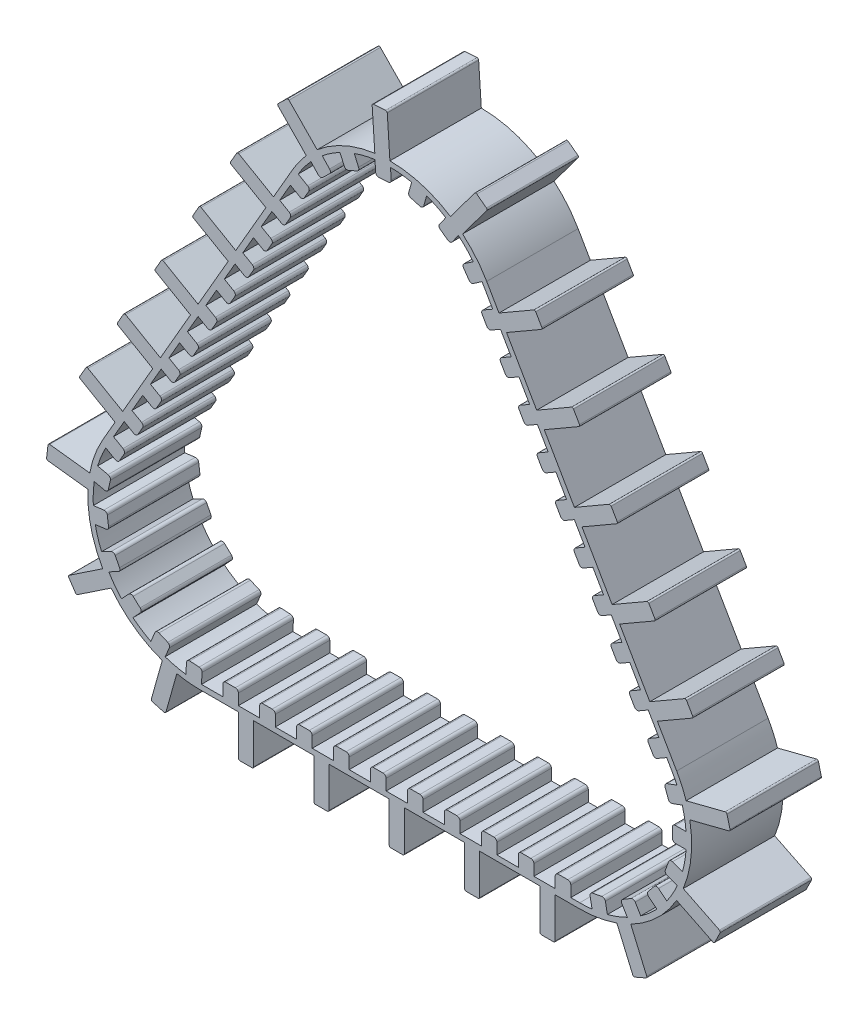
from build123d import *

# Parameters (mm, degrees)
EXTRUDE_THIN1_DEPTH = 60
BOSS_EXTRUDE4_DEPTH = 60
FILLET3_R           = 2
CRVPATTERN6_DEPTH   = 60
BOSS_EXTRUDE5_DEPTH = 60
FILLET4_R           = 1
CRVPATTERN8_DEPTH   = 60


# Read off the part's stored shape, not the designer's step: CrvPattern6, CrvPattern8
with BuildPart() as part:
    # Sketch2 → Extrude-Thin1 (new body)
    with BuildSketch(Plane.XY):
        with BuildLine():
            Line((-249.41531629, -73.5), (0, -73.5))
            ThreePointArc((0, -73.5), (63.652867178, -36.75), (63.652867178, 36.75))
            Line((63.652867178, 36.75), (-61.054790967, 252.75))
            ThreePointArc((-61.054790967, 252.75), (-124.707658145, 289.5), (-188.360525323, 252.75))
            Line((-188.360525323, 252.75), (-313.068183468, 36.75))
            ThreePointArc((-313.068183468, 36.75), (-313.068183468, -36.75), (-249.41531629, -73.5))
        make_face()
        with BuildLine():
            Line((-249.41531629, -70), (0, -70))
            ThreePointArc((0, -70), (60.621778265, -35), (60.621778265, 35))
            Line((60.621778265, 35), (-64.08587988, 251))
            ThreePointArc((-64.08587988, 251), (-124.707658145, 286), (-185.32943641, 251))
            Line((-185.32943641, 251), (-310.037094555, 35))
            ThreePointArc((-310.037094555, 35), (-310.037094555, -35), (-249.41531629, -70))
        make_face(mode=Mode.SUBTRACT)
    extrude(amount=EXTRUDE_THIN1_DEPTH)

    # Sketch4 → Boss-Extrude4 (add)
    with BuildSketch(Plane.XY.offset(60)):
        Polygon((-254.685847855, 112.471171547), (-249.570790282, 121.330711146), (-257.538223997, 125.930711146), (-262.65328157, 117.071171547), align=None)
    extrude(amount=-BOSS_EXTRUDE4_DEPTH)

    # Fillet3
    fillet3_edges = [part.edges().sort_by_distance(p)[0] for p in [
        (-249.570790282, 121.330711146, 30),
        (-254.685847855, 112.471171547, 30),
    ]]
    fillet(fillet3_edges, radius=FILLET3_R)

    # CrvPattern6 outline → CrvPattern6 (add)
    with BuildSketch(Plane.XY):
        with BuildLine():
            ThreePointArc((-244.294746414, 134.46908719), (-242.777108324, 134.269286345), (-241.562695606, 135.201137997))
            Line((-241.562695606, 135.201137997), (-238.447638033, 140.596575981))
            ThreePointArc((-238.447638033, 140.596575981), (-238.247837188, 142.114214072), (-239.179688841, 143.328626789))
            Line((-239.179688841, 143.328626789), (-245.415071748, 146.928626789))
            Line((-245.415071748, 146.928626789), (-250.530129321, 138.06908719))
            Line((-250.530129321, 138.06908719), (-244.294746414, 134.46908719))
        make_face()
        with BuildLine():
            Line((-269.661376246, 104.932795503), (-274.776433819, 96.073255904))
            Line((-274.776433819, 96.073255904), (-268.541050911, 92.473255904))
            ThreePointArc((-268.541050911, 92.473255904), (-267.02341282, 92.273455059), (-265.809000103, 93.205306712))
            Line((-265.809000103, 93.205306712), (-262.693942531, 98.600744696))
            ThreePointArc((-262.693942531, 98.600744696), (-262.494141686, 100.118382786), (-263.425993338, 101.332795503))
            Line((-263.425993338, 101.332795503), (-269.661376246, 104.932795503))
        make_face()
        with BuildLine():
            Line((-281.784528495, 83.934879861), (-286.899586067, 75.075340262))
            Line((-286.899586067, 75.075340262), (-280.66420316, 71.475340262))
            ThreePointArc((-280.66420316, 71.475340262), (-279.14656507, 71.275539417), (-277.932152352, 72.207391069))
            Line((-277.932152352, 72.207391069), (-274.81709478, 77.602829053))
            ThreePointArc((-274.81709478, 77.602829053), (-274.617293935, 79.120467143), (-275.549145587, 80.334879861))
            Line((-275.549145587, 80.334879861), (-281.784528495, 83.934879861))
        make_face()
        with BuildLine():
            Line((-293.907680743, 62.936964218), (-299.022738316, 54.077424619))
            Line((-299.022738316, 54.077424619), (-292.787355408, 50.477424619))
            ThreePointArc((-292.787355408, 50.477424619), (-291.269717318, 50.277623774), (-290.055304601, 51.209475427))
            Line((-290.055304601, 51.209475427), (-286.940247028, 56.604913411))
            ThreePointArc((-286.940247028, 56.604913411), (-286.740446183, 58.122551501), (-287.672297836, 59.336964218))
            Line((-287.672297836, 59.336964218), (-293.907680743, 62.936964218))
        make_face()
        with BuildLine():
            ThreePointArc((-310.037094555, 35), (-310.583954637, 34.035241776), (-311.11546246, 33.061941302))
            Line((-311.11546246, 33.061941302), (-304.910507657, 29.479508976))
            ThreePointArc((-304.910507657, 29.479508976), (-303.392869566, 29.279708131), (-302.178456849, 30.211559784))
            Line((-302.178456849, 30.211559784), (-299.063399277, 35.606997768))
            ThreePointArc((-299.063399277, 35.606997768), (-298.863598432, 37.124635859), (-299.795450085, 38.339048576))
            Line((-299.795450085, 38.339048576), (-306.030832992, 41.939048576))
            Line((-306.030832992, 41.939048576), (-310.037094555, 35))
        make_face()
        with BuildLine():
            ThreePointArc((-316.457199384, 20.134197557), (-317.749224081, 15.181470482), (-318.675887828, 10.147572628))
            Line((-318.675887828, 10.147572628), (-311.829937788, 8.626635339))
            ThreePointArc((-311.829937788, 8.626635339), (-310.322340092, 8.891767267), (-309.443784123, 10.145276405))
            Line((-309.443784123, 10.145276405), (-308.092608277, 16.227106603))
            ThreePointArc((-308.092608277, 16.227106603), (-308.357740205, 17.734704298), (-309.611249343, 18.613260268))
            Line((-309.611249343, 18.613260268), (-316.457199384, 20.134197557))
        make_face()
        with BuildLine():
            ThreePointArc((-319.310913805, -3.821707469), (-318.844797619, -8.918919354), (-318.007462777, -13.968444447))
            Line((-318.007462777, -13.968444447), (-311.051754025, -13.074913281))
            ThreePointArc((-311.051754025, -13.074913281), (-309.723703566, -12.313711778), (-309.322880826, -10.836387547))
            Line((-309.322880826, -10.836387547), (-310.116679319, -4.657049503))
            ThreePointArc((-310.116679319, -4.657049503), (-310.877880823, -3.328999044), (-312.355205053, -2.928176303))
            Line((-312.355205053, -2.928176303), (-319.310913805, -3.821707469))
        make_face()
        with BuildLine():
            ThreePointArc((-313.862328281, -27.323664567), (-311.693437164, -31.959907078), (-309.191563575, -36.425269532))
            Line((-309.191563575, -36.425269532), (-302.952305235, -33.223404832))
            ThreePointArc((-302.952305235, -33.223404832), (-301.961549763, -32.056550366), (-302.086070555, -30.530889748))
            Line((-302.086070555, -30.530889748), (-304.930554857, -24.988034547))
            ThreePointArc((-304.930554857, -24.988034547), (-306.097409323, -23.997279075), (-307.623069941, -24.121799867))
            Line((-307.623069941, -24.121799867), (-313.862328281, -27.323664567))
        make_face()
        with BuildLine():
            ThreePointArc((-300.758633664, -47.580077354), (-297.144591633, -51.204650914), (-293.275355453, -54.555448533))
            Line((-293.275355453, -54.555448533), (-288.493655635, -49.42557241))
            ThreePointArc((-288.493655635, -49.42557241), (-287.957878514, -47.991665639), (-288.592952079, -46.598888802))
            Line((-288.592952079, -46.598888802), (-293.150250239, -42.350904786))
            ThreePointArc((-293.150250239, -42.350904786), (-294.58415701, -41.815127665), (-295.976933846, -42.450201231))
            Line((-295.976933846, -42.450201231), (-300.758633664, -47.580077354))
        make_face()
        with BuildLine():
            ThreePointArc((-281.556305711, -62.184859886), (-276.926393894, -64.367232417), (-272.14938858, -66.205452624))
            Line((-272.14938858, -66.205452624), (-269.393224489, -59.756899166))
            ThreePointArc((-269.393224489, -59.756899166), (-269.376066099, -58.226261606), (-270.446257484, -57.131804594))
            Line((-270.446257484, -57.131804594), (-276.175047049, -54.683273433))
            ThreePointArc((-276.175047049, -54.683273433), (-277.705684609, -54.666115044), (-278.800141621, -55.736306428))
            Line((-278.800141621, -55.736306428), (-281.556305711, -62.184859886))
        make_face()
        with BuildLine():
            Line((-249.41531629, -70), (-248.323526656, -70))
            Line((-248.323526656, -70), (-247.919788576, -62.990215199))
            ThreePointArc((-247.919788576, -62.990215199), (-248.423287016, -61.544658188), (-249.801477342, -60.878522184))
            Line((-249.801477342, -60.878522184), (-256.02128442, -60.520283945))
            ThreePointArc((-256.02128442, -60.520283945), (-257.466841431, -61.023782385), (-258.132977435, -62.40197271))
            Line((-258.132977435, -62.40197271), (-258.53622465, -69.403235016))
            ThreePointArc((-258.53622465, -69.403235016), (-253.985521366, -69.850649428), (-249.41531629, -70))
        make_face()
        with BuildLine():
            Line((-234.311365102, -70), (-224.081249957, -70))
            Line((-224.081249957, -70), (-224.081249957, -62.8))
            ThreePointArc((-224.081249957, -62.8), (-224.667036395, -61.385786437), (-226.081249957, -60.8))
            Line((-226.081249957, -60.8), (-232.311365102, -60.8))
            ThreePointArc((-232.311365102, -60.8), (-233.725578664, -61.385786438), (-234.311365102, -62.8))
            Line((-234.311365102, -62.8), (-234.311365102, -70))
        make_face()
        with BuildLine():
            Line((-210.065060604, -70), (-199.834945459, -70))
            Line((-199.834945459, -70), (-199.834945459, -62.8))
            ThreePointArc((-199.834945459, -62.8), (-200.420731897, -61.385786438), (-201.834945459, -60.8))
            Line((-201.834945459, -60.8), (-208.065060604, -60.8))
            ThreePointArc((-208.065060604, -60.8), (-209.479274167, -61.385786437), (-210.065060604, -62.8))
            Line((-210.065060604, -62.8), (-210.065060604, -70))
        make_face()
        with BuildLine():
            Line((-185.818756107, -70), (-175.588640962, -70))
            Line((-175.588640962, -70), (-175.588640962, -62.8))
            ThreePointArc((-175.588640962, -62.8), (-176.1744274, -61.385786438), (-177.588640962, -60.8))
            Line((-177.588640962, -60.8), (-183.818756107, -60.8))
            ThreePointArc((-183.818756107, -60.8), (-185.232969669, -61.385786438), (-185.818756107, -62.8))
            Line((-185.818756107, -62.8), (-185.818756107, -70))
        make_face()
        with BuildLine():
            Line((-161.57245161, -70), (-151.342336465, -70))
            Line((-151.342336465, -70), (-151.342336465, -62.8))
            ThreePointArc((-151.342336465, -62.8), (-151.928122903, -61.385786438), (-153.342336465, -60.8))
            Line((-153.342336465, -60.8), (-159.57245161, -60.8))
            ThreePointArc((-159.57245161, -60.8), (-160.986665172, -61.385786438), (-161.57245161, -62.8))
            Line((-161.57245161, -62.8), (-161.57245161, -70))
        make_face()
        with BuildLine():
            Line((-137.326147112, -70), (-127.096031967, -70))
            Line((-127.096031967, -70), (-127.096031967, -62.8))
            ThreePointArc((-127.096031967, -62.8), (-127.681818405, -61.385786438), (-129.096031967, -60.8))
            Line((-129.096031967, -60.8), (-135.326147112, -60.8))
            ThreePointArc((-135.326147112, -60.8), (-136.740360675, -61.385786437), (-137.326147112, -62.8))
            Line((-137.326147112, -62.8), (-137.326147112, -70))
        make_face()
        with BuildLine():
            Line((-113.079842615, -70), (-102.84972747, -70))
            Line((-102.84972747, -70), (-102.84972747, -62.8))
            ThreePointArc((-102.84972747, -62.8), (-103.435513907, -61.385786437), (-104.84972747, -60.8))
            Line((-104.84972747, -60.8), (-111.079842615, -60.8))
            ThreePointArc((-111.079842615, -60.8), (-112.494056177, -61.385786438), (-113.079842615, -62.8))
            Line((-113.079842615, -62.8), (-113.079842615, -70))
        make_face()
        with BuildLine():
            Line((-88.833538117, -70), (-78.603422972, -70))
            Line((-78.603422972, -70), (-78.603422972, -62.8))
            ThreePointArc((-78.603422972, -62.8), (-79.18920941, -61.385786438), (-80.603422972, -60.8))
            Line((-80.603422972, -60.8), (-86.833538117, -60.8))
            ThreePointArc((-86.833538117, -60.8), (-88.247751679, -61.385786438), (-88.833538117, -62.8))
            Line((-88.833538117, -62.8), (-88.833538117, -70))
        make_face()
        with BuildLine():
            Line((-64.58723362, -70), (-54.357118475, -70))
            Line((-54.357118475, -70), (-54.357118475, -62.8))
            ThreePointArc((-54.357118475, -62.8), (-54.942904913, -61.385786438), (-56.357118475, -60.8))
            Line((-56.357118475, -60.8), (-62.58723362, -60.8))
            ThreePointArc((-62.58723362, -60.8), (-64.001447182, -61.385786438), (-64.58723362, -62.8))
            Line((-64.58723362, -62.8), (-64.58723362, -70))
        make_face()
        with BuildLine():
            Line((-40.340929123, -70), (-30.110813978, -70))
            Line((-30.110813978, -70), (-30.110813978, -62.8))
            ThreePointArc((-30.110813978, -62.8), (-30.696600416, -61.385786437), (-32.110813978, -60.8))
            Line((-32.110813978, -60.8), (-38.340929123, -60.8))
            ThreePointArc((-38.340929123, -60.8), (-39.755142685, -61.385786438), (-40.340929123, -62.8))
            Line((-40.340929123, -62.8), (-40.340929123, -70))
        make_face()
        with BuildLine():
            Line((-16.094624625, -70), (-5.86450948, -70))
            Line((-5.86450948, -70), (-5.86450948, -62.8))
            ThreePointArc((-5.86450948, -62.8), (-6.450295918, -61.385786438), (-7.86450948, -60.8))
            Line((-7.86450948, -60.8), (-14.094624625, -60.8))
            ThreePointArc((-14.094624625, -60.8), (-15.508838188, -61.385786437), (-16.094624625, -62.8))
            Line((-16.094624625, -62.8), (-16.094624625, -70))
        make_face()
        with BuildLine():
            ThreePointArc((8.128735827, -69.526424141), (13.187457187, -68.746570627), (18.175669161, -67.599149777))
            Line((18.175669161, -67.599149777), (16.854499686, -60.711857609))
            ThreePointArc((16.854499686, -60.711857609), (16.01277555, -59.433324766), (14.513527463, -59.124454368))
            Line((14.513527463, -59.124454368), (8.394969594, -60.29815975))
            ThreePointArc((8.394969594, -60.29815975), (7.116436751, -61.139883886), (6.807566352, -62.639131973))
            Line((6.807566352, -62.639131973), (8.128735827, -69.526424141))
        make_face()
        with BuildLine():
            ThreePointArc((31.249564339, -62.637566433), (35.743091285, -60.186638263), (40.04551062, -57.413910154))
            Line((40.04551062, -57.413910154), (36.464632178, -51.384184474))
            ThreePointArc((36.464632178, -51.384184474), (35.238848166, -50.467342446), (33.723782763, -50.685797418))
            Line((33.723782763, -50.685797418), (28.367072955, -53.866991337))
            ThreePointArc((28.367072955, -53.866991337), (27.450230926, -55.092775349), (27.668685898, -56.607840752))
            Line((27.668685898, -56.607840752), (31.249564339, -62.637566433))
        make_face()
        with BuildLine():
            ThreePointArc((50.6585245, -48.308528186), (54.053109415, -44.477650146), (57.158688534, -40.408963425))
            Line((57.158688534, -40.408963425), (51.743443035, -35.953023751))
            ThreePointArc((51.743443035, -35.953023751), (50.27919954, -35.506776356), (48.928278477, -36.226608301))
            Line((48.928278477, -36.226608301), (44.969694451, -41.037423953))
            ThreePointArc((44.969694451, -41.037423953), (44.523447056, -42.501667448), (45.243279001, -43.852588512))
            Line((45.243279001, -43.852588512), (50.6585245, -48.308528186))
        make_face()
        with BuildLine():
            ThreePointArc((64.050192012, -28.241333242), (65.942621201, -23.485542555), (67.482474934, -18.604181702))
            Line((67.482474934, -18.604181702), (60.876093053, -16.251310979))
            ThreePointArc((60.876093053, -16.251310979), (59.347315031, -16.328664127), (58.32100266, -17.464370369))
            Line((58.32100266, -17.464370369), (56.230750741, -23.333372127))
            ThreePointArc((56.230750741, -23.333372127), (56.308103889, -24.862150149), (57.443810131, -25.88846252))
            Line((57.443810131, -25.88846252), (64.050192012, -28.241333242))
        make_face()
        with BuildLine():
            ThreePointArc((69.833885279, -4.819591979), (69.999373273, 0.296211675), (69.790595571, 5.410431573))
            Line((69.790595571, 5.410431573), (62.777792883, 5.380755964))
            ThreePointArc((62.777792883, 5.380755964), (61.366070793, 4.788990392), (60.78627398, 3.37231068))
            Line((60.78627398, 3.37231068), (60.812637306, -2.857748685))
            ThreePointArc((60.812637306, -2.857748685), (61.404402878, -4.269470774), (62.82108259, -4.849267588))
            Line((62.82108259, -4.849267588), (69.833885279, -4.819591979))
        make_face()
        with BuildLine():
            ThreePointArc((67.32260887, 19.174627375), (65.741498766, 24.042781454), (63.808888546, 28.782385978))
            Line((63.808888546, 28.782385978), (57.222655873, 26.373688949))
            ThreePointArc((57.222655873, 26.373688949), (56.095676104, 25.337801721), (56.03126395, 23.8084238))
            Line((56.03126395, 23.8084238), (58.171111048, 17.957322269))
            ThreePointArc((58.171111048, 17.957322269), (59.206998276, 16.8303425), (60.736376197, 16.765930346))
            Line((60.736376197, 16.765930346), (67.32260887, 19.174627375))
        make_face()
        with BuildLine():
            Line((57.11085342, 41.081100212), (51.995795848, 49.940639812))
            Line((51.995795848, 49.940639812), (45.760412941, 46.340639812))
            ThreePointArc((45.760412941, 46.340639812), (44.828561288, 45.126227095), (45.028362133, 43.608589004))
            Line((45.028362133, 43.608589004), (48.143419706, 38.21315102))
            ThreePointArc((48.143419706, 38.21315102), (49.357832423, 37.281299367), (50.875470513, 37.481100212))
            Line((50.875470513, 37.481100212), (57.11085342, 41.081100212))
        make_face()
        with BuildLine():
            Line((44.987701172, 62.079015855), (39.872643599, 70.938555454))
            Line((39.872643599, 70.938555454), (33.637260692, 67.338555454))
            ThreePointArc((33.637260692, 67.338555454), (32.705409039, 66.124142737), (32.905209884, 64.606504647))
            Line((32.905209884, 64.606504647), (36.020267457, 59.211066662))
            ThreePointArc((36.020267457, 59.211066662), (37.234680174, 58.27921501), (38.752318264, 58.479015855))
            Line((38.752318264, 58.479015855), (44.987701172, 62.079015855))
        make_face()
        with BuildLine():
            Line((32.864548923, 83.076931498), (27.74949135, 91.936471097))
            Line((27.74949135, 91.936471097), (21.514108443, 88.336471097))
            ThreePointArc((21.514108443, 88.336471097), (20.582256791, 87.122058379), (20.782057636, 85.604420289))
            Line((20.782057636, 85.604420289), (23.897115208, 80.208982305))
            ThreePointArc((23.897115208, 80.208982305), (25.111527926, 79.277130653), (26.629166016, 79.476931498))
            Line((26.629166016, 79.476931498), (32.864548923, 83.076931498))
        make_face()
        with BuildLine():
            Line((20.741396674, 104.07484714), (15.626339102, 112.934386739))
            Line((15.626339102, 112.934386739), (9.390956195, 109.334386739))
            ThreePointArc((9.390956195, 109.334386739), (8.459104542, 108.119974022), (8.658905387, 106.602335932))
            Line((8.658905387, 106.602335932), (11.773962959, 101.206897948))
            ThreePointArc((11.773962959, 101.206897948), (12.988375676, 100.275046295), (14.506013767, 100.47484714))
            Line((14.506013767, 100.47484714), (20.741396674, 104.07484714))
        make_face()
        with BuildLine():
            Line((8.618244426, 125.072762783), (3.503186853, 133.932302382))
            Line((3.503186853, 133.932302382), (-2.732196054, 130.332302382))
            ThreePointArc((-2.732196054, 130.332302382), (-3.664047707, 129.117889665), (-3.464246862, 127.600251574))
            Line((-3.464246862, 127.600251574), (-0.349189289, 122.20481359))
            ThreePointArc((-0.349189289, 122.20481359), (0.865223428, 121.272961938), (2.382861518, 121.472762783))
            Line((2.382861518, 121.472762783), (8.618244426, 125.072762783))
        make_face()
        with BuildLine():
            Line((-3.504907823, 146.070678425), (-8.619965396, 154.930218025))
            Line((-8.619965396, 154.930218025), (-14.855348303, 151.330218025))
            ThreePointArc((-14.855348303, 151.330218025), (-15.787199955, 150.115805307), (-15.58739911, 148.598167217))
            Line((-15.58739911, 148.598167217), (-12.472341538, 143.202729233))
            ThreePointArc((-12.472341538, 143.202729233), (-11.257928821, 142.27087758), (-9.74029073, 142.470678425))
            Line((-9.74029073, 142.470678425), (-3.504907823, 146.070678425))
        make_face()
        with BuildLine():
            Line((-15.628060072, 167.068594068), (-20.743117644, 175.928133667))
            Line((-20.743117644, 175.928133667), (-26.978500552, 172.328133667))
            ThreePointArc((-26.978500552, 172.328133667), (-27.910352204, 171.11372095), (-27.710551359, 169.59608286))
            Line((-27.710551359, 169.59608286), (-24.595493787, 164.200644876))
            ThreePointArc((-24.595493787, 164.200644876), (-23.38108107, 163.268793223), (-21.863442979, 163.468594068))
            Line((-21.863442979, 163.468594068), (-15.628060072, 167.068594068))
        make_face()
        with BuildLine():
            Line((-27.75121232, 188.066509711), (-32.866269893, 196.92604931))
            Line((-32.866269893, 196.92604931), (-39.1016528, 193.32604931))
            ThreePointArc((-39.1016528, 193.32604931), (-40.033504453, 192.111636593), (-39.833703608, 190.593998502))
            Line((-39.833703608, 190.593998502), (-36.718646035, 185.198560518))
            ThreePointArc((-36.718646035, 185.198560518), (-35.504233318, 184.266708866), (-33.986595228, 184.466509711))
            Line((-33.986595228, 184.466509711), (-27.75121232, 188.066509711))
        make_face()
        with BuildLine():
            Line((-39.874364569, 209.064425353), (-44.989422142, 217.923964953))
            Line((-44.989422142, 217.923964953), (-51.224805049, 214.323964953))
            ThreePointArc((-51.224805049, 214.323964953), (-52.156656702, 213.109552236), (-51.956855857, 211.591914145))
            Line((-51.956855857, 211.591914145), (-48.841798284, 206.196476161))
            ThreePointArc((-48.841798284, 206.196476161), (-47.627385567, 205.264624508), (-46.109747476, 205.464425353))
            Line((-46.109747476, 205.464425353), (-39.874364569, 209.064425353))
        make_face()
        with BuildLine():
            Line((-51.997516818, 230.062340996), (-57.11257439, 238.921880595))
            Line((-57.11257439, 238.921880595), (-63.347957298, 235.321880595))
            ThreePointArc((-63.347957298, 235.321880595), (-64.27980895, 234.107467878), (-64.080008105, 232.589829788))
            Line((-64.080008105, 232.589829788), (-60.964950533, 227.194391804))
            ThreePointArc((-60.964950533, 227.194391804), (-59.750537816, 226.262540151), (-58.232899725, 226.462340996))
            Line((-58.232899725, 226.462340996), (-51.997516818, 230.062340996))
        make_face()
        with BuildLine():
            ThreePointArc((-64.118413713, 251.056289866), (-66.842032003, 255.389964601), (-69.875040476, 259.513032985))
            Line((-69.875040476, 259.513032985), (-75.67223836, 255.566796944))
            ThreePointArc((-75.67223836, 255.566796944), (-76.511670449, 254.28675807), (-76.200114404, 252.78806578))
            Line((-76.200114404, 252.78806578), (-72.69434276, 247.637929869))
            ThreePointArc((-72.69434276, 247.637929869), (-71.414303886, 246.79849778), (-69.915611596, 247.110053825))
            Line((-69.915611596, 247.110053825), (-64.118413713, 251.056289866))
        make_face()
        with BuildLine():
            ThreePointArc((-79.618149954, 269.543778827), (-83.651254454, 272.69542941), (-87.903875255, 275.543946501))
            Line((-87.903875255, 275.543946501), (-92.017061484, 269.863983365))
            ThreePointArc((-92.017061484, 269.863983365), (-92.372077331, 268.374987226), (-91.570232177, 267.071073847))
            Line((-91.570232177, 267.071073847), (-86.5242457, 263.416986384))
            ThreePointArc((-86.5242457, 263.416986384), (-85.035249562, 263.061970537), (-83.731336183, 263.86381569))
            Line((-83.731336183, 263.86381569), (-79.618149954, 269.543778827))
        make_face()
        with BuildLine():
            ThreePointArc((-100.47368305, 281.671260465), (-105.337215786, 283.266529291), (-110.304316479, 284.502144119))
            Line((-110.304316479, 284.502144119), (-112.244920858, 277.763128105))
            ThreePointArc((-112.244920858, 277.763128105), (-112.073351168, 276.242039813), (-110.876461231, 275.287786058))
            Line((-110.876461231, 275.287786058), (-104.889629475, 273.563784825))
            ThreePointArc((-104.889629475, 273.563784825), (-103.368541183, 273.735354514), (-102.414287428, 274.932244451))
            Line((-102.414287428, 274.932244451), (-100.47368305, 281.671260465))
        make_face()
        with BuildLine():
            ThreePointArc((-124.207762682, 285.99821501), (-129.324026217, 285.847613745), (-134.415607414, 285.323558196))
            Line((-134.415607414, 285.323558196), (-133.953122153, 278.325959353))
            ThreePointArc((-133.953122153, 278.325959353), (-133.275346222, 276.953455969), (-131.825579815, 276.462209476))
            Line((-131.825579815, 276.462209476), (-125.609027297, 276.873073829))
            ThreePointArc((-125.609027297, 276.873073829), (-124.236523914, 277.55084976), (-123.745277421, 279.000616166))
            Line((-123.745277421, 279.000616166), (-124.207762682, 285.99821501))
        make_face()
        with BuildLine():
            ThreePointArc((-148.001220619, 282.010680555), (-152.762497787, 280.132097835), (-157.373774124, 277.910619984))
            Line((-157.373774124, 277.910619984), (-154.56313389, 271.485623201))
            ThreePointArc((-154.56313389, 271.485623201), (-153.459658921, 270.424732659), (-151.929221391, 270.454844396))
            Line((-151.929221391, 270.454844396), (-146.221359191, 272.951771272))
            ThreePointArc((-146.221359191, 272.951771272), (-145.160468648, 274.055246241), (-145.190580385, 275.585683771))
            Line((-145.190580385, 275.585683771), (-148.001220619, 282.010680555))
        make_face()
        with BuildLine():
            ThreePointArc((-169.027835588, 270.182302197), (-172.868575015, 266.798878789), (-176.451812435, 263.143848982))
            Line((-176.451812435, 263.143848982), (-171.626869131, 258.054624649))
            ThreePointArc((-171.626869131, 258.054624649), (-170.228767473, 257.431361058), (-168.799446398, 257.979254309))
            Line((-168.799446398, 257.979254309), (-164.278262625, 262.265655131))
            ThreePointArc((-164.278262625, 262.265655131), (-163.654999034, 263.663756789), (-164.202892285, 265.093077865))
            Line((-164.202892285, 265.093077865), (-169.027835588, 270.182302197))
        make_face()
        with BuildLine():
            Line((-185.32943641, 251), (-189.914368077, 243.058665403))
            Line((-189.914368077, 243.058665403), (-183.67898517, 239.458665403))
            ThreePointArc((-183.67898517, 239.458665403), (-182.16134708, 239.258864558), (-180.946934363, 240.19071621))
            Line((-180.946934363, 240.19071621), (-177.83187679, 245.586154194))
            ThreePointArc((-177.83187679, 245.586154194), (-177.632075945, 247.103792285), (-178.563927598, 248.318205002))
            Line((-178.563927598, 248.318205002), (-184.792356331, 251.914190008))
            ThreePointArc((-184.792356331, 251.914190008), (-185.062627287, 251.458111905), (-185.32943641, 251))
        make_face()
        with BuildLine():
            Line((-196.922462754, 230.920289359), (-202.037520326, 222.06074976))
            Line((-202.037520326, 222.06074976), (-195.802137419, 218.46074976))
            ThreePointArc((-195.802137419, 218.46074976), (-194.284499328, 218.260948915), (-193.070086611, 219.192800568))
            Line((-193.070086611, 219.192800568), (-189.955029039, 224.588238552))
            ThreePointArc((-189.955029039, 224.588238552), (-189.755228194, 226.105876642), (-190.687079846, 227.320289359))
            Line((-190.687079846, 227.320289359), (-196.922462754, 230.920289359))
        make_face()
        with BuildLine():
            Line((-209.045615002, 209.922373717), (-214.160672575, 201.062834117))
            Line((-214.160672575, 201.062834117), (-207.925289667, 197.462834117))
            ThreePointArc((-207.925289667, 197.462834117), (-206.407651577, 197.263033272), (-205.19323886, 198.194884925))
            Line((-205.19323886, 198.194884925), (-202.078181287, 203.590322909))
            ThreePointArc((-202.078181287, 203.590322909), (-201.878380442, 205.107961), (-202.810232095, 206.322373717))
            Line((-202.810232095, 206.322373717), (-209.045615002, 209.922373717))
        make_face()
        with BuildLine():
            Line((-221.168767251, 188.924458074), (-226.283824823, 180.064918475))
            Line((-226.283824823, 180.064918475), (-220.048441916, 176.464918475))
            ThreePointArc((-220.048441916, 176.464918475), (-218.530803826, 176.26511763), (-217.316391109, 177.196969282))
            Line((-217.316391109, 177.196969282), (-214.201333536, 182.592407266))
            ThreePointArc((-214.201333536, 182.592407266), (-214.001532691, 184.110045357), (-214.933384344, 185.324458074))
            Line((-214.933384344, 185.324458074), (-221.168767251, 188.924458074))
        make_face()
        with BuildLine():
            Line((-233.2919195, 167.926542431), (-238.406977072, 159.067002832))
            Line((-238.406977072, 159.067002832), (-232.171594165, 155.467002832))
            ThreePointArc((-232.171594165, 155.467002832), (-230.653956074, 155.267201987), (-229.439543357, 156.19905364))
            Line((-229.439543357, 156.19905364), (-226.324485785, 161.594491624))
            ThreePointArc((-226.324485785, 161.594491624), (-226.12468494, 163.112129714), (-227.056536592, 164.326542431))
            Line((-227.056536592, 164.326542431), (-233.2919195, 167.926542431))
        make_face()
    extrude(amount=CRVPATTERN6_DEPTH)

    # Sketch6 → Boss-Extrude5 (add)
    with BuildSketch(Plane.XY.offset(60)):
        Polygon((-136.308864095, 316.253168116), (-126.401592242, 316.907959468), (-124.406757868, 286.725266347), (-134.314029721, 286.070474994), align=None)
    extrude(amount=-BOSS_EXTRUDE5_DEPTH)

    # Fillet4
    fillet4_edges = [part.edges().sort_by_distance(p)[0] for p in [
        (-126.401592242, 316.907959468, 30),
        (-136.308864095, 316.253168116, 30),
    ]]
    fillet(fillet4_edges, radius=FILLET4_R)

    # CrvPattern8 outline → CrvPattern8 (add)
    with BuildSketch(Plane.XY):
        with BuildLine():
            ThreePointArc((-67.591407991, 299.151011892), (-68.333266762, 299.339245794), (-68.990941598, 298.947773895))
            Line((-68.990941598, 298.947773895), (-84.82262764, 277.736815123))
            ThreePointArc((-84.82262764, 277.736815123), (-80.743794517, 274.901856463), (-76.865758962, 271.797873458))
            Line((-76.865758962, 271.797873458), (-61.034072919, 293.008832229))
            ThreePointArc((-61.034072919, 293.008832229), (-60.845839018, 293.750691), (-61.237310917, 294.408365836))
            Line((-61.237310917, 294.408365836), (-67.591407991, 299.151011892))
        make_face()
        with BuildLine():
            Line((-197.962453997, 283.958962481), (-179.476921648, 265.016097105))
            ThreePointArc((-179.476921648, 265.016097105), (-176.041130848, 268.603465478), (-172.370883027, 271.95057635))
            Line((-172.370883027, 271.95057635), (-190.856415376, 290.893441726))
            ThreePointArc((-190.856415376, 290.893441726), (-191.559890817, 291.19495249), (-192.270523378, 290.91072054))
            Line((-192.270523378, 290.91072054), (-197.945175183, 285.373070484))
            ThreePointArc((-197.945175183, 285.373070484), (-198.246685947, 284.669595042), (-197.962453997, 283.958962481))
        make_face()
        with BuildLine():
            Line((-228.780032887, 235.341359283), (-206.003564767, 222.191359283))
            Line((-206.003564767, 222.191359283), (-201.039121513, 230.79002723))
            Line((-201.039121513, 230.79002723), (-223.815589633, 243.94002723))
            ThreePointArc((-223.815589633, 243.94002723), (-224.574408678, 244.039927652), (-225.181615037, 243.574001826))
            Line((-225.181615037, 243.574001826), (-229.146058291, 236.707384686))
            ThreePointArc((-229.146058291, 236.707384686), (-229.245958713, 235.948565641), (-228.780032887, 235.341359283))
        make_face()
        with BuildLine():
            Line((-253.531468728, 192.470614846), (-230.755000608, 179.320614846))
            Line((-230.755000608, 179.320614846), (-225.790557354, 187.919282793))
            Line((-225.790557354, 187.919282793), (-248.567025474, 201.069282793))
            ThreePointArc((-248.567025474, 201.069282793), (-249.325844519, 201.169183215), (-249.933050878, 200.703257389))
            Line((-249.933050878, 200.703257389), (-253.897494132, 193.836640249))
            ThreePointArc((-253.897494132, 193.836640249), (-253.997394554, 193.077821204), (-253.531468728, 192.470614846))
        make_face()
        with BuildLine():
            Line((-278.282904569, 149.599870409), (-255.506436449, 136.449870409))
            Line((-255.506436449, 136.449870409), (-250.541993196, 145.048538355))
            Line((-250.541993196, 145.048538355), (-273.318461315, 158.198538355))
            ThreePointArc((-273.318461315, 158.198538355), (-274.07728036, 158.298438778), (-274.684486719, 157.832512952))
            Line((-274.684486719, 157.832512952), (-278.648929973, 150.965895812))
            ThreePointArc((-278.648929973, 150.965895812), (-278.748830395, 150.207076767), (-278.282904569, 149.599870409))
        make_face()
        with BuildLine():
            Line((-303.03434041, 106.729125972), (-280.257872291, 93.579125972))
            Line((-280.257872291, 93.579125972), (-275.293429037, 102.177793918))
            Line((-275.293429037, 102.177793918), (-298.069897156, 115.327793918))
            ThreePointArc((-298.069897156, 115.327793918), (-298.828716201, 115.427694341), (-299.43592256, 114.961768515))
            Line((-299.43592256, 114.961768515), (-303.400365814, 108.095151375))
            ThreePointArc((-303.400365814, 108.095151375), (-303.500266236, 107.33633233), (-303.03434041, 106.729125972))
        make_face()
        with BuildLine():
            Line((-327.785776251, 63.858381534), (-305.009308132, 50.708381534))
            Line((-305.009308132, 50.708381534), (-300.044864878, 59.307049481))
            Line((-300.044864878, 59.307049481), (-322.821332997, 72.457049481))
            ThreePointArc((-322.821332997, 72.457049481), (-323.580152042, 72.556949904), (-324.187358401, 72.091024078))
            Line((-324.187358401, 72.091024078), (-328.151801655, 65.224406938))
            ThreePointArc((-328.151801655, 65.224406938), (-328.251702078, 64.465587893), (-327.785776251, 63.858381534))
        make_face()
        with BuildLine():
            Line((-349.108553943, 6.778204998), (-322.823481788, 3.673042086))
            ThreePointArc((-322.823481788, 3.673042086), (-322.407752132, 8.622894519), (-321.658641774, 13.533363329))
            Line((-321.658641774, 13.533363329), (-347.943713929, 16.638526241))
            ThreePointArc((-347.943713929, 16.638526241), (-348.680299421, 16.430612196), (-349.054126587, 15.762750169))
            Line((-349.054126587, 15.762750169), (-349.984330016, 7.888617656))
            ThreePointArc((-349.984330016, 7.888617656), (-349.776415971, 7.152032163), (-349.108553943, 6.778204998))
        make_face()
        with BuildLine():
            Line((-329.605337658, -59.617498856), (-307.606159636, -44.900732184))
            ThreePointArc((-307.606159636, -44.900732184), (-310.506021344, -40.867783841), (-313.126861508, -36.648178753))
            Line((-313.126861508, -36.648178753), (-335.12603953, -51.364945425))
            ThreePointArc((-335.12603953, -51.364945425), (-335.550906945, -52.001556858), (-335.401181315, -52.75213575))
            Line((-335.401181315, -52.75213575), (-330.992527983, -59.34235707))
            ThreePointArc((-330.992527983, -59.34235707), (-330.35591655, -59.767224486), (-329.605337658, -59.617498856))
        make_face()
        with BuildLine():
            Line((-271.642106288, -97.419995397), (-264.479869825, -71.939622092))
            ThreePointArc((-264.479869825, -71.939622092), (-269.304517369, -70.757824164), (-274.038324324, -69.252851749))
            Line((-274.038324324, -69.252851749), (-281.200560786, -94.733225054))
            ThreePointArc((-281.200560786, -94.733225054), (-281.109939046, -95.493208039), (-280.508470676, -95.966517914))
            Line((-280.508470676, -95.966517914), (-272.875399148, -98.112085507))
            ThreePointArc((-272.875399148, -98.112085507), (-272.115416163, -98.021463767), (-271.642106288, -97.419995397))
        make_face()
        with BuildLine():
            Line((-214.129237401, -99.8), (-214.129237401, -73.5))
            Line((-214.129237401, -73.5), (-224.058123909, -73.5))
            Line((-224.058123909, -73.5), (-224.058123909, -99.8))
            ThreePointArc((-224.058123909, -99.8), (-223.76523069, -100.507106781), (-223.058123909, -100.8))
            Line((-223.058123909, -100.8), (-215.129237401, -100.8))
            ThreePointArc((-215.129237401, -100.8), (-214.42213062, -100.507106781), (-214.129237401, -99.8))
        make_face()
        with BuildLine():
            Line((-164.626365719, -99.8), (-164.626365719, -73.5))
            Line((-164.626365719, -73.5), (-174.555252227, -73.5))
            Line((-174.555252227, -73.5), (-174.555252227, -99.8))
            ThreePointArc((-174.555252227, -99.8), (-174.262359008, -100.507106781), (-173.555252227, -100.8))
            Line((-173.555252227, -100.8), (-165.626365719, -100.8))
            ThreePointArc((-165.626365719, -100.8), (-164.919258938, -100.507106781), (-164.626365719, -99.8))
        make_face()
        with BuildLine():
            Line((-115.123494037, -99.8), (-115.123494037, -73.5))
            Line((-115.123494037, -73.5), (-125.052380545, -73.5))
            Line((-125.052380545, -73.5), (-125.052380545, -99.8))
            ThreePointArc((-125.052380545, -99.8), (-124.759487326, -100.507106781), (-124.052380545, -100.8))
            Line((-124.052380545, -100.8), (-116.123494037, -100.8))
            ThreePointArc((-116.123494037, -100.8), (-115.416387256, -100.507106781), (-115.123494037, -99.8))
        make_face()
        with BuildLine():
            Line((-65.620622355, -99.8), (-65.620622355, -73.5))
            Line((-65.620622355, -73.5), (-75.549508863, -73.5))
            Line((-75.549508863, -73.5), (-75.549508863, -99.8))
            ThreePointArc((-75.549508863, -99.8), (-75.256615644, -100.507106781), (-74.549508863, -100.8))
            Line((-74.549508863, -100.8), (-66.620622355, -100.8))
            ThreePointArc((-66.620622355, -100.8), (-65.913515574, -100.507106781), (-65.620622355, -99.8))
        make_face()
        with BuildLine():
            Line((-16.117750673, -99.8), (-16.117750673, -73.5))
            Line((-16.117750673, -73.5), (-26.04663718, -73.5))
            Line((-26.04663718, -73.5), (-26.04663718, -99.8))
            ThreePointArc((-26.04663718, -99.8), (-25.753743962, -100.507106781), (-25.04663718, -100.8))
            Line((-25.04663718, -100.8), (-17.117750673, -100.8))
            ThreePointArc((-17.117750673, -100.8), (-16.410643892, -100.507106781), (-16.117750673, -99.8))
        make_face()
        with BuildLine():
            Line((43.976521107, -89.725978892), (33.523134994, -65.40985721))
            ThreePointArc((33.523134994, -65.40985721), (29.028572213, -67.524750983), (24.4014263, -69.331236788))
            Line((24.4014263, -69.331236788), (34.854812413, -93.64735847))
            ThreePointArc((34.854812413, -93.64735847), (35.403164004, -94.181303196), (36.168463069, -94.171116005))
            Line((36.168463069, -94.171116005), (43.452763572, -91.039629548))
            ThreePointArc((43.452763572, -91.039629548), (43.986708298, -90.491277957), (43.976521107, -89.725978892))
        make_face()
        with BuildLine():
            Line((91.725279203, -39.637846207), (67.980596393, -27.944382513))
            ThreePointArc((67.980596393, -27.944382513), (65.937891529, -32.472210591), (63.594026412, -36.851727296))
            Line((63.594026412, -36.851727296), (87.338709222, -48.54519099))
            ThreePointArc((87.338709222, -48.54519099), (88.102464603, -48.594831249), (88.677622176, -48.089875603))
            Line((88.677622176, -48.089875603), (92.18059459, -40.976759161))
            ThreePointArc((92.18059459, -40.976759161), (92.230234849, -40.21300378), (91.725279203, -39.637846207))
        make_face()
        with BuildLine():
            Line((95.48158585, 29.461032916), (69.833817038, 22.923524988))
            ThreePointArc((69.833817038, 22.923524988), (71.222673782, 18.154358687), (72.286232916, 13.302275399))
            Line((72.286232916, 13.302275399), (97.934001727, 19.839783327))
            ThreePointArc((97.934001727, 19.839783327), (98.546855429, 20.298255549), (98.65601962, 21.055797375))
            Line((98.65601962, 21.055797375), (96.697599897, 28.739015023))
            ThreePointArc((96.697599897, 28.739015023), (96.239127675, 29.351868725), (95.48158585, 29.461032916))
        make_face()
        with BuildLine():
            Line((68.786295853, 80.458640717), (46.009827734, 67.308640717))
            Line((46.009827734, 67.308640717), (50.974270988, 58.70997277))
            Line((50.974270988, 58.70997277), (73.750739107, 71.85997277))
            ThreePointArc((73.750739107, 71.85997277), (74.216664934, 72.467179129), (74.116764511, 73.225998174))
            Line((74.116764511, 73.225998174), (70.152321257, 80.092615314))
            ThreePointArc((70.152321257, 80.092615314), (69.545114898, 80.55854114), (68.786295853, 80.458640717))
        make_face()
        with BuildLine():
            Line((44.034860012, 123.329385154), (21.258391893, 110.179385154))
            Line((21.258391893, 110.179385154), (26.222835147, 101.580717207))
            Line((26.222835147, 101.580717207), (48.999303266, 114.730717207))
            ThreePointArc((48.999303266, 114.730717207), (49.465229092, 115.337923566), (49.36532867, 116.096742611))
            Line((49.36532867, 116.096742611), (45.400885416, 122.963359751))
            ThreePointArc((45.400885416, 122.963359751), (44.793679057, 123.429285577), (44.034860012, 123.329385154))
        make_face()
        with BuildLine():
            Line((19.283424171, 166.200129591), (-3.493043948, 153.050129591))
            Line((-3.493043948, 153.050129591), (1.471399305, 144.451461645))
            Line((1.471399305, 144.451461645), (24.247867425, 157.601461645))
            ThreePointArc((24.247867425, 157.601461645), (24.713793251, 158.208668003), (24.613892829, 158.967487048))
            Line((24.613892829, 158.967487048), (20.649449575, 165.834104188))
            ThreePointArc((20.649449575, 165.834104188), (20.042243216, 166.300030014), (19.283424171, 166.200129591))
        make_face()
        with BuildLine():
            Line((-5.46801167, 209.070874028), (-28.244479789, 195.920874028))
            Line((-28.244479789, 195.920874028), (-23.280036536, 187.322206082))
            Line((-23.280036536, 187.322206082), (-0.503568416, 200.472206082))
            ThreePointArc((-0.503568416, 200.472206082), (-0.03764259, 201.07941244), (-0.137543012, 201.838231485))
            Line((-0.137543012, 201.838231485), (-4.101986266, 208.704848625))
            ThreePointArc((-4.101986266, 208.704848625), (-4.709192625, 209.170774451), (-5.46801167, 209.070874028))
        make_face()
        with BuildLine():
            Line((-30.219447511, 251.941618466), (-52.99591563, 238.791618466))
            Line((-52.99591563, 238.791618466), (-48.031472377, 230.192950519))
            Line((-48.031472377, 230.192950519), (-25.255004257, 243.342950519))
            ThreePointArc((-25.255004257, 243.342950519), (-24.789078431, 243.950156877), (-24.888978853, 244.708975922))
            Line((-24.888978853, 244.708975922), (-28.853422107, 251.575593062))
            ThreePointArc((-28.853422107, 251.575593062), (-29.460628466, 252.041518888), (-30.219447511, 251.941618466))
        make_face()
    extrude(amount=CRVPATTERN8_DEPTH)


solid = part.part
